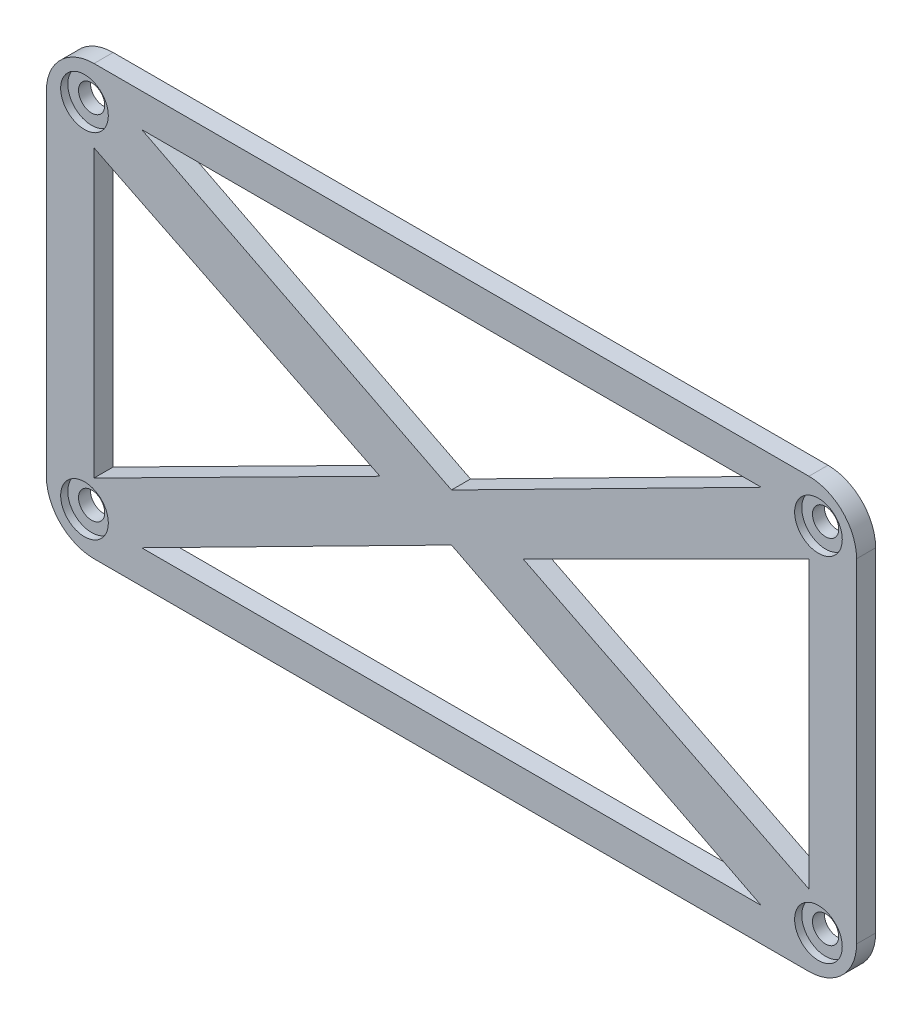
from build123d import *

# Parameters (mm, degrees)
EXTRUDE_1_DEPTH          = 4
CUT_EXTRUDE_1_DEPTH      = 39
CUT_EXTRUDE_1_DEPTH_BACK = 10
SKETCH_2_R               = 2.75
SKETCH_3_R               = 5
CUT_EXTRUDE_2_DEPTH      = 1.5


with BuildPart() as part:
    # 草图1 → 凸台-拉伸1 (new body)
    with BuildSketch(Plane.XY):
        with BuildLine():
            Line((-72.574116531, 45.487390308), (77.425883469, 45.487390308))
            ThreePointArc((77.425883469, 45.487390308), (84.496951281, 42.558458119), (87.425883469, 35.487390308))
            Line((87.425883469, 35.487390308), (87.425883469, -34.512609692))
            ThreePointArc((87.425883469, -34.512609692), (84.496951281, -41.583677504), (77.425883469, -44.512609692))
            Line((77.425883469, -44.512609692), (-72.574116531, -44.512609692))
            ThreePointArc((-72.574116531, -44.512609692), (-79.645184343, -41.583677504), (-82.574116531, -34.512609692))
            Line((-82.574116531, -34.512609692), (-82.574116531, 35.487390308))
            ThreePointArc((-82.574116531, 35.487390308), (-79.645184343, 42.558458119), (-72.574116531, 45.487390308))
        make_face()
    extrude(amount=EXTRUDE_1_DEPTH)

    # 草图2 → 切除-拉伸1 (cut, two sides: drawn at the far end of the back side and taken through both)
    with BuildSketch(Plane.XY.offset(4).offset(-CUT_EXTRUDE_1_DEPTH_BACK)):
        with Locations((-74.574116531, 37.487390308)):
            Circle(SKETCH_2_R)
        with Locations((-74.574116531, -36.512609692)):
            Circle(SKETCH_2_R)
        with Locations((79.425883469, 37.487390308)):
            Circle(SKETCH_2_R)
        with Locations((79.425883469, -36.512609692)):
            Circle(SKETCH_2_R)
        Polygon((-62.574116531, 38.487390308), (2.425883469, 5.487390308), (67.425883469, 38.487390308), align=None)
        Polygon((-72.574116531, 30.156085606), (-12.574116531, 0.487390308), (-72.574116531, -29.843914394), align=None)
        Polygon((2.425883469, -4.512609692), (-62.574116531, -37.512609692), (67.425883469, -37.512609692), align=None)
        Polygon((17.425883469, 0.487390308), (77.425883469, 30.487390308), (77.425883469, -29.512609692), align=None)
    extrude(amount=CUT_EXTRUDE_1_DEPTH + CUT_EXTRUDE_1_DEPTH_BACK, mode=Mode.SUBTRACT)

    # 草图3 → 切除-拉伸2 (cut)
    with BuildSketch(Plane.XY.offset(4)):
        with Locations((-74.574116531, 37.487390308)):
            Circle(SKETCH_3_R)
        with Locations((79.425883469, 37.487390308)):
            Circle(SKETCH_3_R)
        with Locations((79.425883469, -36.512609692)):
            Circle(SKETCH_3_R)
        with Locations((-74.574116531, -36.512609692)):
            Circle(SKETCH_3_R)
    extrude(amount=-CUT_EXTRUDE_2_DEPTH, mode=Mode.SUBTRACT)


solid = part.part
